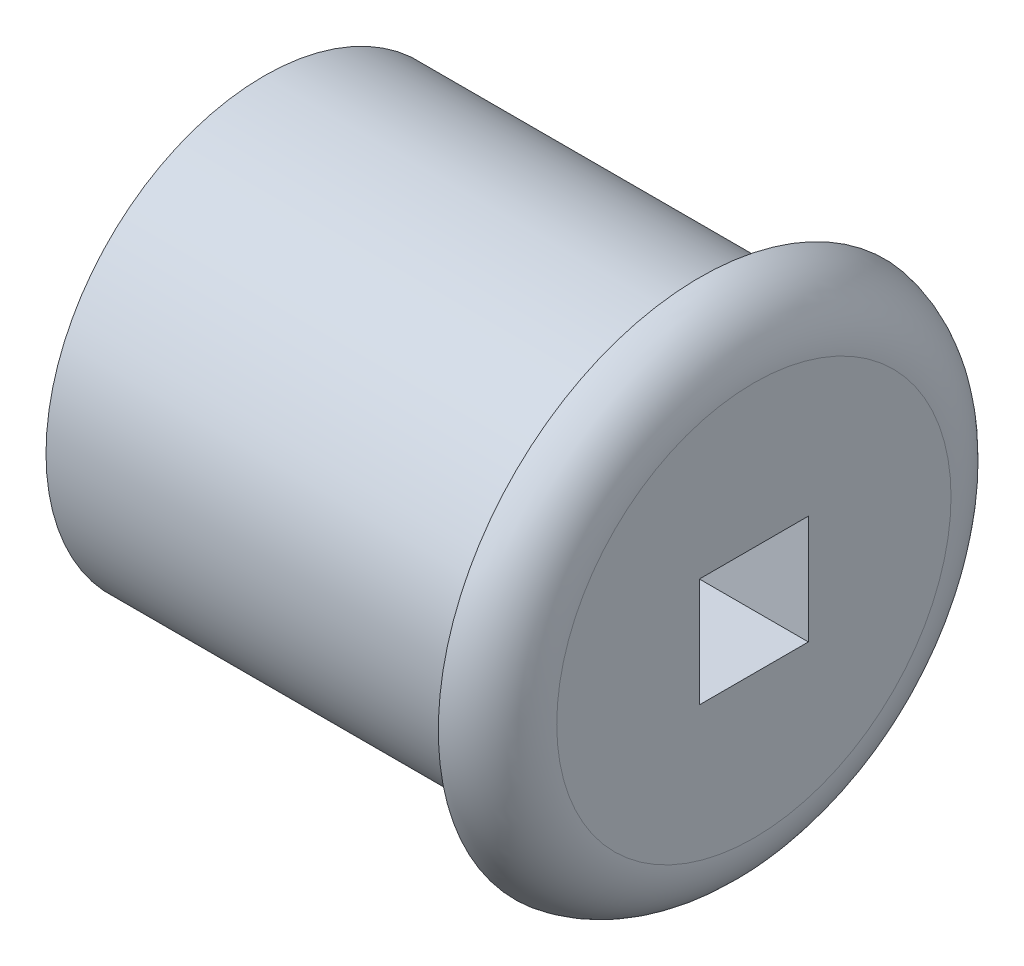
from build123d import *

# Parameters (mm, degrees)
SKETCH1_R           = 12.7
BOSS_EXTRUDE1_DEPTH = 25.4
SKETCH2_R           = 15.24
BOSS_EXTRUDE2_DEPTH = 3.1496
FILLET1_R           = 3.81
SKETCH5_W           = 6.35
SKETCH5_H           = 6.35
CUT_EXTRUDE2_DEPTH  = 12.7


with BuildPart() as part:
    # Sketch1 → Boss-Extrude1 (new body)
    with BuildSketch(Plane(origin=(0, 0, 0), x_dir=(0, 0, -1), z_dir=(1, 0, 0))):
        Circle(SKETCH1_R)
    extrude(amount=BOSS_EXTRUDE1_DEPTH)

    # Sketch2 → Boss-Extrude2 (add)
    with BuildSketch(Plane(origin=(25.4, 0, 0), x_dir=(0, 0, -1), z_dir=(1, 0, 0))):
        Circle(SKETCH2_R)
    extrude(amount=BOSS_EXTRUDE2_DEPTH)

    # Fillet1
    # the kernel refuses this fillet: 3.81 mm, written as the material it takes off along each edge
    with BuildSketch(Plane(origin=(28.5496, 0, 0), x_dir=(0, 0, -1), z_dir=(0, -1, 0))) as fillet1_piece_1:
        with BuildLine():
            CenterArc((11.487671144, -3.81), FILLET1_R, 9.98168298, 80.01831702)
            Line((11.487671144, 0), (11.487671144, 0.0762))
            Line((11.487671144, 0.0762), (15.24, 0.0762))
            Line((15.24, 0.0762), (15.3162, 0))
            ThreePointArc((15.3162, 0), (15.3162, -1.5748), (15.315046577, -3.136392))
            Line((15.315046577, -3.136392), (15.24, -3.1496))
        make_face()
    revolve(axis=Axis((28.5496, 0, 0), (1, 0, 0)), mode=Mode.SUBTRACT)

    # Sketch5 → Cut-Extrude2 (cut)
    with BuildSketch(Plane(origin=(28.5496, 0, 0), x_dir=(0, 0, -1), z_dir=(1, 0, 0))):
        Rectangle(SKETCH5_W, SKETCH5_H)
    extrude(amount=-CUT_EXTRUDE2_DEPTH, mode=Mode.SUBTRACT)


solid = part.part
